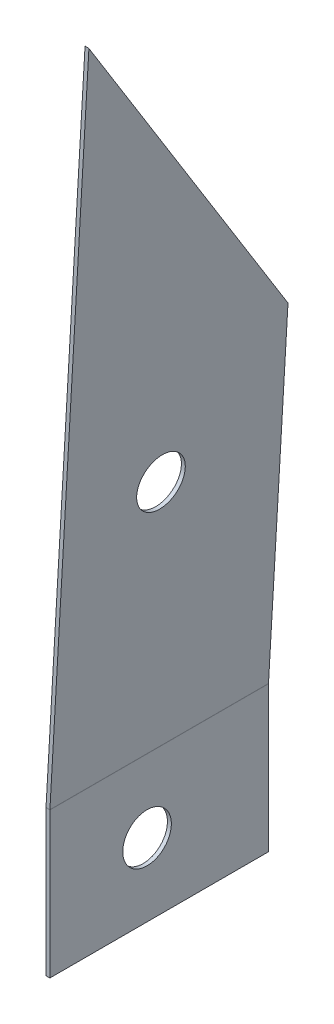
from build123d import *

# Parameters (mm, degrees)
SM_BASE_FLANGE_1_DEPTH = 225
CUT_EXTRUDE_1_DEPTH    = 10
SKETCH_7_R             = 25
CUT_EXTRUDE_2_DEPTH    = 10
SKETCH_8_R             = 25
CUT_EXTRUDE_3_DEPTH    = 10


# Sheet-metal steps are written as plain solids
with BuildPart() as part:
    # Sketch 1 → 基体-法兰1 (new body)
    with BuildSketch(Plane.XY):
        with BuildLine():
            Line((0, 0), (0, 149.77025154))
            ThreePointArc((0, 149.77025154), (0.003296983, 149.999905315), (0.013185214, 150.2293698))
            Line((0.013185214, 150.2293698), (40.172847796, 848.846293758))
            Line((40.172847796, 848.846293758), (44.166255189, 848.616734628))
            Line((44.166255189, 848.616734628), (4.006592607, 149.99981067))
            ThreePointArc((4.006592607, 149.99981067), (4.001648491, 149.885078427), (4, 149.77025154))
            Line((4, 149.77025154), (4, 0))
            Line((4, 0), (0, 0))
        make_face()
    extrude(amount=SM_BASE_FLANGE_1_DEPTH)

    # 草图6 → 切除-拉伸1 (cut)
    with BuildSketch(Plane(origin=(-8.594279324, 0.494038071, 0), x_dir=(0, 0, 1), z_dir=(-0.9983518482263736, 0.0573897825660991, 0))):
        Polygon((0, 849.752777234), (225, 849.752777234), (0, 499.752777234), align=None)
    extrude(amount=-CUT_EXTRUDE_1_DEPTH, mode=Mode.SUBTRACT)

    # 草图7 → 切除-拉伸2 (cut)
    with BuildSketch(Plane.ZY):
        with Locations((125, 75)):
            Circle(SKETCH_7_R)
    extrude(amount=-CUT_EXTRUDE_2_DEPTH, mode=Mode.SUBTRACT)

    # 草图8 → 切除-拉伸3 (cut)
    with BuildSketch(Plane(origin=(-8.594279324, 0.494038071, 0), x_dir=(0, 0, 1), z_dir=(-0.9983518482263735, 0.05738978256609909, 0))):
        with Locations(Location((125, 399.752777234, 0), (0, 0, 270))):
            Circle(SKETCH_8_R)
    extrude(amount=-CUT_EXTRUDE_3_DEPTH, mode=Mode.SUBTRACT)


solid = part.part
